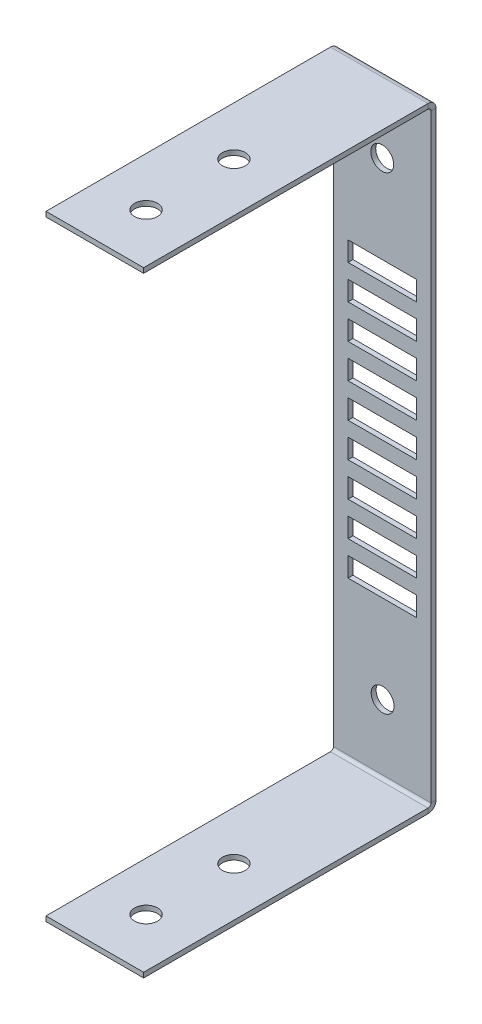
from build123d import *

# Parameters (mm, degrees)
SKETCH1_W                  = 20
SKETCH1_H                  = 242.6825
SKETCH1_R                  = 2.35
BASE_FLANGE1_DEPTH         = 1.016
SKETCHED_START             = -20
SKETCHED_BEND1_DEPTH       = 20
SKETCHED_BEND1_2_DEPTH     = 7.6499999
SKETCHED_START_2           = -7.6499999
SKETCHED_BEND1_3_DEPTH     = 7.6499999
SKETCHED_START_3           = -12.3500001
SKETCHED_BEND1_4_DEPTH     = 4.7000002
SKETCHED_START_4           = 58.325262761
SKETCHED_BEND1_5_OUTLINE_R = 2.35
SKETCHED_BEND1_5_DEPTH     = 126.031974478
SKETCH7_R                  = 2.35
CUT_EXTRUDE1_DEPTH         = 10
SKETCH8_W                  = 14
SKETCH8_H                  = 4
CUT_EXTRUDE2_DEPTH         = 1.016


with BuildPart() as part:
    # Base-Flange1: sheet metal written as solids
    # Sketch1 → Base-Flange1 (new body)
    with BuildSketch(Plane.XY):
        with Locations((-10, 121.34125)):
            Rectangle(SKETCH1_W, SKETCH1_H)
        with Locations((-10, 28.5)):
            Circle(SKETCH1_R, mode=Mode.SUBTRACT)
        with Locations((-10, 10.5)):
            Circle(SKETCH1_R, mode=Mode.SUBTRACT)
        with Locations((-10, 232.1825)):
            Circle(SKETCH1_R, mode=Mode.SUBTRACT)
        with Locations((-10, 214.1825)):
            Circle(SKETCH1_R, mode=Mode.SUBTRACT)
    extrude(amount=-BASE_FLANGE1_DEPTH)

    # Sketched Bend1: read off the stored shape, not the designer's step
    # Sketched Bend1 outline → Sketched Bend1 (cut)
    with BuildSketch(Plane.YZ.offset(SKETCHED_START)):
        with BuildLine():
            ThreePointArc((184.238608772, 0), (183.640375265, -0.738276315), (182.731637239, -1.016))
            Line((182.731637239, -1.016), (242.6825, -1.016))
            Line((242.6825, -1.016), (242.6825, 0))
            Line((242.6825, 0), (184.238608772, 0))
        make_face()
        with BuildLine():
            Line((0, -1.016), (59.950862761, -1.016))
            ThreePointArc((59.950862761, -1.016), (59.042124735, -0.738276315), (58.443891228, 0))
            Line((58.443891228, 0), (0, 0))
            Line((0, 0), (0, -1.016))
        make_face()
    extrude(amount=SKETCHED_BEND1_DEPTH, mode=Mode.SUBTRACT)

    # Sketched Bend1 2 outline → Sketched Bend1 2 (add)
    with BuildSketch(Plane.YZ.offset(SKETCHED_START)):
        with BuildLine():
            Line((182.731637239, 0), (184.238608772, 0))
            ThreePointArc((184.238608772, 0), (184.327304542, 0.299082338), (184.357237239, 0.6096))
            Line((184.357237239, 0.6096), (184.357237239, 58.884737239))
            Line((184.357237239, 58.884737239), (183.341237239, 58.884737239))
            Line((183.341237239, 58.884737239), (183.341237239, 0.6096))
            ThreePointArc((183.341237239, 0.6096), (183.162689533, 0.178547706), (182.731637239, 0))
        make_face()
        with BuildLine():
            ThreePointArc((58.325262761, 0.6096), (58.355195458, 0.299082338), (58.443891228, 0))
            Line((58.443891228, 0), (59.950862761, 0))
            ThreePointArc((59.950862761, 0), (59.519810467, 0.178547706), (59.341262761, 0.6096))
            Line((59.341262761, 0.6096), (59.341262761, 58.884737239))
            Line((59.341262761, 58.884737239), (58.325262761, 58.884737239))
            Line((58.325262761, 58.884737239), (58.325262761, 0.6096))
        make_face()
    extrude(amount=SKETCHED_BEND1_2_DEPTH)

    # Sketched Bend1 3 outline → Sketched Bend1 3 (add)
    with BuildSketch(Plane.YZ.offset(SKETCHED_START_2)):
        with BuildLine():
            Line((182.731637239, 0), (184.238608772, 0))
            ThreePointArc((184.238608772, 0), (184.327304542, 0.299082338), (184.357237239, 0.6096))
            Line((184.357237239, 0.6096), (184.357237239, 58.884737239))
            Line((184.357237239, 58.884737239), (183.341237239, 58.884737239))
            Line((183.341237239, 58.884737239), (183.341237239, 0.6096))
            ThreePointArc((183.341237239, 0.6096), (183.162689533, 0.178547706), (182.731637239, 0))
        make_face()
        with BuildLine():
            ThreePointArc((58.325262761, 0.6096), (58.355195458, 0.299082338), (58.443891228, 0))
            Line((58.443891228, 0), (59.950862761, 0))
            ThreePointArc((59.950862761, 0), (59.519810467, 0.178547706), (59.341262761, 0.6096))
            Line((59.341262761, 0.6096), (59.341262761, 58.884737239))
            Line((59.341262761, 58.884737239), (58.325262761, 58.884737239))
            Line((58.325262761, 58.884737239), (58.325262761, 0.6096))
        make_face()
    extrude(amount=SKETCHED_BEND1_3_DEPTH)

    # Sketched Bend1 4 outline → Sketched Bend1 4 (add)
    with BuildSketch(Plane.YZ.offset(SKETCHED_START_3)):
        with BuildLine():
            Line((182.731637239, 0), (184.238608772, 0))
            ThreePointArc((184.238608772, 0), (184.327304542, 0.299082338), (184.357237239, 0.6096))
            Line((184.357237239, 0.6096), (184.357237239, 58.884737239))
            Line((184.357237239, 58.884737239), (183.341237239, 58.884737239))
            Line((183.341237239, 58.884737239), (183.341237239, 0.6096))
            ThreePointArc((183.341237239, 0.6096), (183.162689533, 0.178547706), (182.731637239, 0))
        make_face()
        with BuildLine():
            Line((58.443891228, 0), (59.950862761, 0))
            ThreePointArc((59.950862761, 0), (59.519810467, 0.178547706), (59.341262761, 0.6096))
            Line((59.341262761, 0.6096), (59.341262761, 58.884737239))
            Line((59.341262761, 58.884737239), (58.325262761, 58.884737239))
            Line((58.325262761, 58.884737239), (58.325262761, 0.6096))
            ThreePointArc((58.325262761, 0.6096), (58.355195458, 0.299082338), (58.443891228, 0))
        make_face()
    extrude(amount=SKETCHED_BEND1_4_DEPTH)

    # Sketched Bend1 5 outline → Sketched Bend1 5 (cut)
    with BuildSketch(Plane(origin=(0, 0, 0), x_dir=(1, 0, 0), z_dir=(0, 1, 0)).offset(SKETCHED_START_4)):
        with Locations((-10, -30.384737239)):
            Circle(SKETCHED_BEND1_5_OUTLINE_R)
        with Locations((-10, -48.384737239)):
            Circle(SKETCHED_BEND1_5_OUTLINE_R)
    extrude(amount=SKETCHED_BEND1_5_DEPTH, mode=Mode.SUBTRACT)

    # Sketch7 → Cut-Extrude1 (cut)
    with BuildSketch(Plane(origin=(0, 0, -1.016), x_dir=(-1, 0, 0), z_dir=(0, 0, -1))):
        with Locations((9.918784011, 73.325262761)):
            Circle(SKETCH7_R)
        with Locations((10, 169.357237239)):
            Circle(SKETCH7_R)
    extrude(amount=-CUT_EXTRUDE1_DEPTH, mode=Mode.SUBTRACT)

    # Sketch8 → Cut-Extrude2 (cut)
    with BuildSketch(Plane(origin=(0, 0, -1.016), x_dir=(-1, 0, 0), z_dir=(0, 0, -1))):
        with Locations((10, 149.34125)):
            Rectangle(SKETCH8_W, SKETCH8_H)
        with Locations((10, 142.34125)):
            Rectangle(SKETCH8_W, SKETCH8_H)
        with Locations((10, 135.34125)):
            Rectangle(SKETCH8_W, SKETCH8_H)
        with Locations((10, 128.34125)):
            Rectangle(SKETCH8_W, SKETCH8_H)
        with Locations((10, 121.34125)):
            Rectangle(SKETCH8_W, SKETCH8_H)
        with Locations((10, 114.34125)):
            Rectangle(SKETCH8_W, SKETCH8_H)
        with Locations((10, 107.34125)):
            Rectangle(SKETCH8_W, SKETCH8_H)
        with Locations((10, 100.34125)):
            Rectangle(SKETCH8_W, SKETCH8_H)
        with Locations((10, 93.34125)):
            Rectangle(SKETCH8_W, SKETCH8_H)
    extrude(amount=-CUT_EXTRUDE2_DEPTH, mode=Mode.SUBTRACT)


solid = part.part
